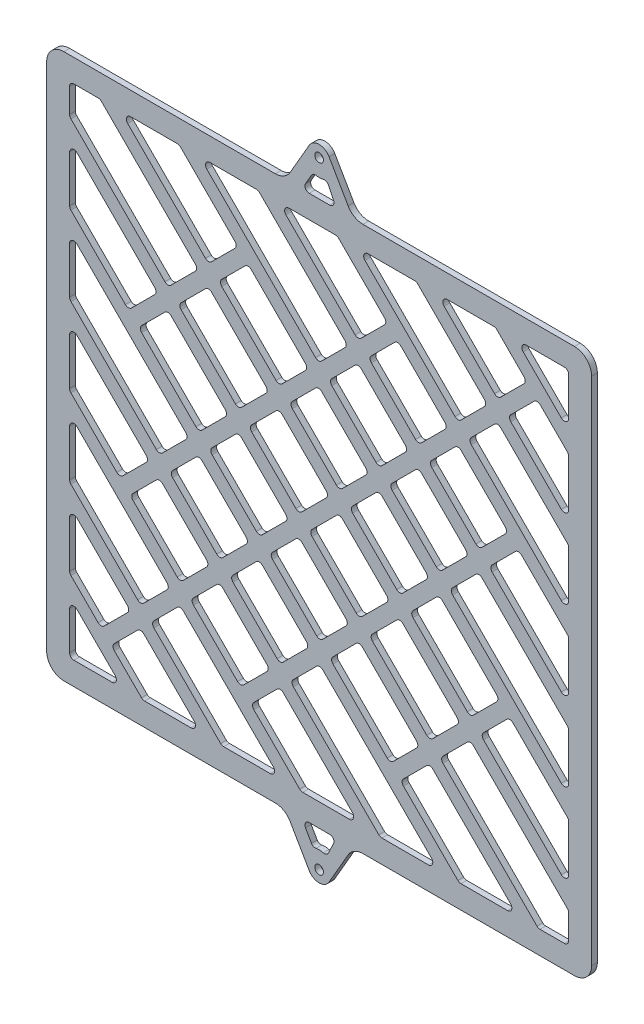
from build123d import *

# Parameters (mm, degrees)
SKETCH_1_W          = 190
SKETCH_1_H          = 190
EXTRUDE_1_DEPTH     = 2
SKETCH_2_R          = 1.525
EXTRUDE_2_DEPTH     = 2
FILLET_1_R          = 6
CUT_EXTRUDE_1_DEPTH = 2
EXTRUDE_3_DEPTH     = 2
EXTRUDE_4_DEPTH     = 2
CUT_EXTRUDE_2_DEPTH = 2
FILLET_2_R          = 1.5


with BuildPart() as part:
    # 草图1 → 凸台-拉伸1 (new body)
    with BuildSketch(Plane.XY):
        Rectangle(SKETCH_1_W, SKETCH_1_H)
    extrude(amount=EXTRUDE_1_DEPTH)

    # 草图2 → 凸台-拉伸2 (add)
    # profile 1 of 2: a face of its own
    with BuildSketch(Plane.XY.offset(2)):
        with BuildLine():
            Line((-3.464101615, 109.5), (-11.835680518, 95))
            Line((-11.835680518, 95), (11.835680518, 95))
            Line((11.835680518, 95), (3.464101615, 109.5))
            ThreePointArc((3.464101615, 109.5), (0, 111.5), (-3.464101615, 109.5))
        make_face()
        with Locations((0, 107.5)):
            Circle(SKETCH_2_R, mode=Mode.SUBTRACT)
    # profile 2 of 2: a face of its own
    with BuildSketch(Plane.XY.offset(2)):
        with BuildLine():
            Line((-11.835680518, -95), (11.835680518, -95))
            Line((11.835680518, -95), (3.464101615, -109.5))
            ThreePointArc((3.464101615, -109.5), (0, -111.5), (-3.464101615, -109.5))
            Line((-3.464101615, -109.5), (-11.835680518, -95))
        make_face()
        with Locations((0, -107.5)):
            Circle(SKETCH_2_R, mode=Mode.SUBTRACT)
    extrude(amount=-EXTRUDE_2_DEPTH)

    # 圆角1
    fillet_1_edges = [part.edges().sort_by_distance(p)[0] for p in [
        (-11.835680518, -95, 1),
        (11.835680518, -95, 1),
        (11.835680518, 95, 1),
        (-11.835680518, 95, 1),
        (95, -95, 1),
        (-95, -95, 1),
        (-95, 95, 1),
        (95, 95, 1),
    ]]
    fillet(fillet_1_edges, radius=FILLET_1_R)

    # 草图5 → 切除-拉伸1 (cut)
    with BuildSketch(Plane(origin=(0, 0, 0), x_dir=(-1, 0, 0), z_dir=(0, 0, -1))):
        Polygon((-87, -69.32233047), (69.32233047, 87), (48.816233816, 87), (-87, -48.816233816), align=None)
        Polygon((-87, -41.745166004), (41.745166004, 87), (21.23906935, 87), (-87, -21.23906935), align=None)
        Polygon((-87, -14.168001538), (14.168001538, 87), (-6.338095117, 87), (-87, 6.338095117), align=None)
        Polygon((-87, 13.409162928), (-13.409162928, 87), (-33.915259583, 87), (-87, 33.915259583), align=None)
        Polygon((-87, 40.986327395), (-40.986327395, 87), (-61.492424049, 87), (-87, 61.492424049), align=None)
        Polygon((-87, 68.563491861), (-68.563491861, 87), (-87, 87), align=None)
        Polygon((87, 48.816233816), (87, 69.32233047), (-69.32233047, -87), (-48.816233816, -87), align=None)
        Polygon((87, 87), (76.393398282, 87), (-87, -76.393398282), (-87, -87), (-76.393398282, -87), (87, 76.393398282), align=None)
        Polygon((87, 21.23906935), (87, 41.745166004), (-41.745166004, -87), (-21.23906935, -87), align=None)
        Polygon((87, -6.338095117), (87, 14.168001538), (-14.168001538, -87), (6.338095117, -87), align=None)
        Polygon((87, -33.915259583), (87, -13.409162928), (13.409162928, -87), (33.915259583, -87), align=None)
        Polygon((87, -61.492424049), (87, -40.986327395), (40.986327395, -87), (61.492424049, -87), align=None)
        Polygon((87, -87), (87, -68.563491861), (68.563491861, -87), align=None)
    extrude(amount=-CUT_EXTRUDE_1_DEPTH, mode=Mode.SUBTRACT)

    # 草图6 → 凸台-拉伸3 (add)
    with BuildSketch(Plane(origin=(0, 0, 0), x_dir=(-1, 0, 0), z_dir=(0, 0, -1))):
        Polygon((-76.013978978, 72.478445072), (72.478445072, -76.013978978), (76.013978978, -72.478445072), (-72.478445072, 76.013978978), align=None)
    extrude(amount=-EXTRUDE_3_DEPTH)

    # 草图7 → 凸台-拉伸4 (add)
    with BuildSketch(Plane(origin=(0, 0, 0), x_dir=(-1, 0, 0), z_dir=(0, 0, -1))):
        with BuildLine():
            Line((-69.486174209, 23.851920908), (23.851920908, -69.486174209))
            ThreePointArc((23.851920908, -69.486174209), (27.387454814, -69.486174209), (27.387454814, -65.950640303))
            Line((27.387454814, -65.950640303), (-65.950640303, 27.387454814))
            ThreePointArc((-65.950640303, 27.387454814), (-69.486174209, 27.387454814), (-69.486174209, 23.851920908))
        make_face()
        with BuildLine():
            Line((-66.495112524, -28.31134634), (-28.31134634, -66.495112524))
            ThreePointArc((-28.31134634, -66.495112524), (-24.775812434, -66.495112524), (-24.775812434, -62.959578618))
            Line((-24.775812434, -62.959578618), (-62.959578618, -24.775812434))
            ThreePointArc((-62.959578618, -24.775812434), (-66.495112524, -24.775812434), (-66.495112524, -28.31134634))
        make_face()
        with BuildLine():
            Line((24.775812434, 62.959578618), (62.959578618, 24.775812434))
            ThreePointArc((62.959578618, 24.775812434), (66.495112524, 24.775812434), (66.495112524, 28.31134634))
            Line((66.495112524, 28.31134634), (28.31134634, 66.495112524))
            ThreePointArc((28.31134634, 66.495112524), (24.775812434, 66.495112524), (24.775812434, 62.959578618))
        make_face()
        with BuildLine():
            Line((-27.387454814, 65.950640303), (65.950640303, -27.387454814))
            ThreePointArc((65.950640303, -27.387454814), (69.486174209, -27.387454814), (69.486174209, -23.851920908))
            Line((69.486174209, -23.851920908), (-23.851920908, 69.486174209))
            ThreePointArc((-23.851920908, 69.486174209), (-27.387454814, 69.486174209), (-27.387454814, 65.950640303))
        make_face()
    extrude(amount=-EXTRUDE_4_DEPTH)

    # 草图8 → 切除-拉伸2 (cut)
    with BuildSketch(Plane(origin=(0, 0, 0), x_dir=(-1, 0, 0), z_dir=(0, 0, -1))):
        with BuildLine():
            Line((-2.61819065, 102.101381869), (-6.062177826, 95))
            Line((-6.062177826, 95), (6.062177826, 95))
            Line((6.062177826, 95), (2.092014488, 101.876524617))
            ThreePointArc((2.092014488, 101.876524617), (-0.286104062, 101.506825176), (-2.61819065, 102.101381869))
        make_face()
        with BuildLine():
            Line((6.062177826, -95), (2.092014488, -101.876524617))
            ThreePointArc((2.092014488, -101.876524617), (-0.286104062, -101.506825176), (-2.61819065, -102.101381869))
            Line((-2.61819065, -102.101381869), (-6.062177826, -95))
            Line((-6.062177826, -95), (6.062177826, -95))
        make_face()
    extrude(amount=-CUT_EXTRUDE_2_DEPTH, mode=Mode.SUBTRACT)

    # 圆角2
    fillet_2_edges = [part.edges().sort_by_distance(p)[0] for p in [
        (-87, 69.32233047, 1),
        (-87, 48.816233816, 1),
        (48.816233816, -87, 1),
        (69.32233047, -87, 1),
        (68.563491861, 87, 1),
        (87, 68.563491861, 1),
        (87, 87, 1),
        (-87, 41.745166004, 1),
        (-87, 21.23906935, 1),
        (21.23906935, -87, 1),
        (41.745166004, -87, 1),
        (-87, 76.393398282, 1),
        (76.393398282, -87, 1),
        (87, -87, 1),
        (87, -76.393398282, 1),
        (-76.393398282, 87, 1),
        (-87, 87, 1),
        (6.338095117, 87, 1),
        (-14.168001538, 87, 1),
        (87, -14.168001538, 1),
        (87, 6.338095117, 1),
        (-21.23906935, 87, 1),
        (-41.745166004, 87, 1),
        (87, -41.745166004, 1),
        (87, -21.23906935, 1),
        (61.492424049, 87, 1),
        (40.986327395, 87, 1),
        (87, 40.986327395, 1),
        (87, 61.492424049, 1),
        (33.915259583, 87, 1),
        (13.409162928, 87, 1),
        (87, 13.409162928, 1),
        (87, 33.915259583, 1),
        (-87, -40.986327395, 1),
        (-87, -61.492424049, 1),
        (-61.492424049, -87, 1),
        (-40.986327395, -87, 1),
        (-87, -68.563491861, 1),
        (-87, -87, 1),
        (-68.563491861, -87, 1),
        (-87, 14.168001538, 1),
        (-87, -6.338095117, 1),
        (-6.338095117, -87, 1),
        (14.168001538, -87, 1),
        (-87, -13.409162928, 1),
        (-87, -33.915259583, 1),
        (-33.915259583, -87, 1),
        (-13.409162928, -87, 1),
        (-48.816233816, 87, 1),
        (-69.32233047, 87, 1),
        (87, -69.32233047, 1),
        (87, -48.816233816, 1),
        (-7.071067812, -10.606601718, 1),
        (-10.606601718, -7.071067812, 1),
        (3.535533906, 7.071067812, 1),
        (7.071067812, 10.606601718, 1),
        (-65.76093065, -62.225396744, 1),
        (-62.225396744, -58.689862838, 1),
        (-51.972348417, -48.436814511, 1),
        (-48.436814511, -44.901280605, 1),
        (44.901280605, 48.436814511, 1),
        (48.436814511, 51.972348417, 1),
        (58.689862838, 62.225396744, 1),
        (17.324116139, 20.859650045, 1),
        (20.859650045, 24.395183951, 1),
        (31.112698372, 34.648232278, 1),
        (34.648232278, 38.183766184, 1),
        (-7.071067812, -3.535533906, 1),
        (-38.183766184, -34.648232278, 1),
        (-34.648232278, -31.112698372, 1),
        (-24.395183951, -20.859650045, 1),
        (-20.859650045, -17.324116139, 1),
        (7.071067812, 3.535533906, 1),
        (10.606601718, 7.071067812, 1),
        (-62.225396744, -65.76093065, 1),
        (-58.689862838, -62.225396744, 1),
        (-48.436814511, -51.972348417, 1),
        (-44.901280605, -48.436814511, 1),
        (-72.478445072, -76.013978978, 1),
        (48.436814511, 44.901280605, 1),
        (51.972348417, 48.436814511, 1),
        (62.225396744, 58.689862838, 1),
        (20.859650045, 17.324116139, 1),
        (24.395183951, 20.859650045, 1),
        (34.648232278, 31.112698372, 1),
        (38.183766184, 34.648232278, 1),
        (-3.535533906, -7.071067812, 1),
        (-34.648232278, -38.183766184, 1),
        (-31.112698372, -34.648232278, 1),
        (-20.859650045, -24.395183951, 1),
        (-17.324116139, -20.859650045, 1),
        (76.013978978, 72.478445072, 1),
        (62.225396744, 65.76093065, 1),
        (72.478445072, 76.013978978, 1),
        (-76.013978978, -72.478445072, 1),
        (65.76093065, 62.225396744, 1),
        (13.978291885, -31.655961415, 1),
        (10.44275798, -28.120427509, 1),
        (24.584893603, -13.978291885, 1),
        (28.120427509, -10.44275798, 1),
        (38.373475836, -0.189709652, 1),
        (41.909009742, 3.345824254, 1),
        (52.16205807, 13.598872581, 1),
        (13.978291885, -24.584893603, 1),
        (-17.134406487, -55.697591975, 1),
        (-13.598872581, -52.16205807, 1),
        (-3.345824254, -41.909009742, 1),
        (0.189709652, -38.373475836, 1),
        (28.120427509, -17.513825791, 1),
        (31.655961415, -13.978291885, 1),
        (-23.851920908, -69.486174209, 1),
        (41.909009742, -3.725243558, 1),
        (45.444543648, -0.189709652, 1),
        (55.697591975, 10.063338675, 1),
        (17.513825791, -28.120427509, 1),
        (-13.598872581, -59.233125881, 1),
        (-10.063338675, -55.697591975, 1),
        (0.189709652, -45.444543648, 1),
        (3.725243558, -41.909009742, 1),
        (69.486174209, 23.851920908, 1),
        (55.697591975, 17.134406487, 1),
        (65.950640303, 27.387454814, 1),
        (-27.387454814, -65.950640303, 1),
        (59.233125881, 13.598872581, 1),
        (38.564394667, -56.242064197, 1),
        (35.028860761, -52.706530291, 1),
        (49.170996385, -38.564394667, 1),
        (38.564394667, -49.170996385, 1),
        (52.706530291, -42.099928573, 1),
        (42.099928573, -52.706530291, 1),
        (28.31134634, -66.495112524, 1),
        (66.495112524, -28.31134634, 1),
        (52.706530291, -35.028860761, 1),
        (62.959578618, -24.775812434, 1),
        (24.775812434, -62.959578618, 1),
        (56.242064197, -38.564394667, 1),
        (-17.513825791, 28.120427509, 1),
        (-13.978291885, 31.655961415, 1),
        (-3.725243558, 41.909009742, 1),
        (-0.189709652, 45.444543648, 1),
        (10.063338675, 55.697591975, 1),
        (-31.655961415, 13.978291885, 1),
        (-28.120427509, 17.513825791, 1),
        (-59.233125881, -13.598872581, 1),
        (-55.697591975, -10.063338675, 1),
        (-45.444543648, 0.189709652, 1),
        (-41.909009742, 3.725243558, 1),
        (-13.978291885, 24.584893603, 1),
        (-10.44275798, 28.120427509, 1),
        (-65.950640303, -27.387454814, 1),
        (-0.189709652, 38.373475836, 1),
        (3.345824254, 41.909009742, 1),
        (13.598872581, 52.16205807, 1),
        (-28.120427509, 10.44275798, 1),
        (-24.584893603, 13.978291885, 1),
        (-55.697591975, -17.134406487, 1),
        (-52.16205807, -13.598872581, 1),
        (-41.909009742, -3.345824254, 1),
        (-38.373475836, 0.189709652, 1),
        (27.387454814, 65.950640303, 1),
        (13.598872581, 59.233125881, 1),
        (23.851920908, 69.486174209, 1),
        (-69.486174209, -23.851920908, 1),
        (17.134406487, 55.697591975, 1),
        (-42.099928573, 52.706530291, 1),
        (-56.242064197, 38.564394667, 1),
        (-52.706530291, 42.099928573, 1),
        (-38.564394667, 49.170996385, 1),
        (-52.706530291, 35.028860761, 1),
        (-49.170996385, 38.564394667, 1),
        (-62.959578618, 24.775812434, 1),
        (-24.775812434, 62.959578618, 1),
        (-38.564394667, 56.242064197, 1),
        (-28.31134634, 66.495112524, 1),
        (-66.495112524, 28.31134634, 1),
        (-35.028860761, 52.706530291, 1),
        (2.61819065, 102.101381869, 1),
        (-2.092014488, 101.876524617, 1),
        (-6.062177826, 95, 1),
        (6.062177826, 95, 1),
        (-2.092014488, -101.876524617, 1),
        (2.61819065, -102.101381869, 1),
        (6.062177826, -95, 1),
        (-6.062177826, -95, 1),
    ]]
    fillet(fillet_2_edges, radius=FILLET_2_R)


solid = part.part
